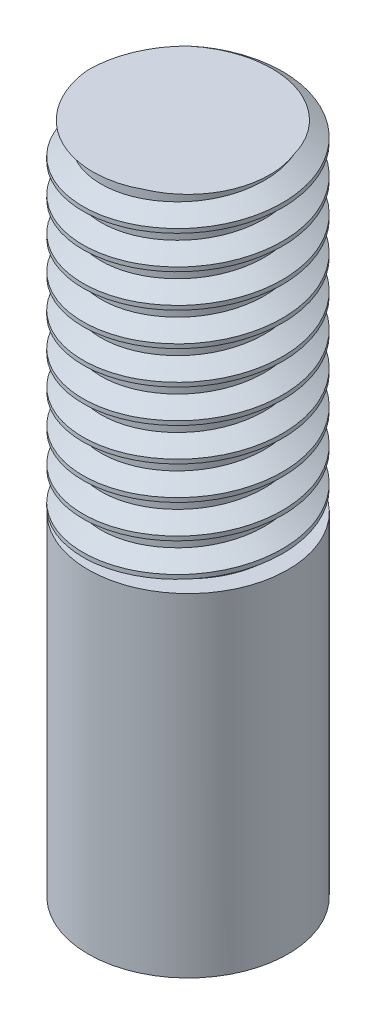
from build123d import *

# Parameters (mm, degrees)
SKETCH1_R           = 3
BOSS_EXTRUDE1_DEPTH = 10
THREAD1_PITCH       = 1
SKETCH13_R          = 3
BOSS_EXTRUDE2_DEPTH = 10


with BuildPart() as part:
    # Sketch1 → Boss-Extrude1 (new body)
    with BuildSketch(Plane(origin=(0, 0, 0), x_dir=(1, 0, 0), z_dir=(0, 1, 0))):
        with Locations(Location((-0.003925922, 0, 0), (0, 0, 270))):
            Circle(SKETCH1_R)
    extrude(amount=BOSS_EXTRUDE1_DEPTH)

    # Thread1: the profile of Thread Profile2 profile screwed along a right-hand helix of 12 turns, 8 arcs to a turn; built about Z, then put on its axis
    thread1_z = Axis((0, 0, 0), (0, 0, 1))
    thread1_corners = [(3.0003, 0, -0.000173205), (3.0003, 0, 0.875173202), (2.458734125, 0, 0.562499999), (2.458734125, 0, 0.312499999)]
    with BuildLine(mode=Mode.PRIVATE) as thread1_profile:
        Line(thread1_corners[0], thread1_corners[1])
        Line(thread1_corners[1], thread1_corners[2])
        Line(thread1_corners[2], thread1_corners[3])
        Line(thread1_corners[3], thread1_corners[0])
    thread1_cap = Face(thread1_profile.wire())
    thread1_turn_angles = [0, 22.5, 45, 67.5, 90, 112.5, 135, 157.5, 180, 202.5, 225, 247.5, 270, 292.5, 315, 337.5, 360]
    thread1_turn_weights = [1, 0.9238795325112867, 1, 0.9238795325112867, 1, 0.9238795325112867, 1, 0.9238795325112867, 1, 0.9238795325112867, 1, 0.9238795325112867, 1, 0.9238795325112867, 1, 0.9238795325112867, 1]
    thread1_turn_rails = [Edge.make_bspline([Vector(p[0], p[1], 0).rotate(thread1_z, thread1_turn_angles[k]) / thread1_turn_weights[k] + Vector(0, 0, p[2] + THREAD1_PITCH * thread1_turn_angles[k] / 360) for k in range(17)], [0, 0, 0, 1, 1, 2, 2, 3, 3, 4, 4, 5, 5, 6, 6, 7, 7, 8, 8, 8], 2, thread1_turn_weights) for p in thread1_corners]
    thread1_turn_sides = [Face.make_surface_from_curves(thread1_turn_rails[p[0]], thread1_turn_rails[p[1]]) for p in [(0, 1), (1, 2), (2, 3), (3, 0)]]
    thread1 = Plane(origin=(-0.003925922, 11, 0), x_dir=(-1, 0, 0), z_dir=(0, -1, 0)) * Solid(Shell([*[p.moved(Location((0, 0, THREAD1_PITCH * i))) for i in range(12) for p in thread1_turn_sides], thread1_cap, thread1_cap.rotate(thread1_z, 4320).moved(Location((0, 0, THREAD1_PITCH * 4320 / 360)))]))
    add(thread1, mode=Mode.SUBTRACT)

    # Sketch13 → Boss-Extrude2 (add)
    with BuildSketch(Plane(origin=(0, 0, 0), x_dir=(1, 0, 0), z_dir=(0, 1, 0))):
        with Locations(Location((0, 0, 0), (0, 0, 270))):
            Circle(SKETCH13_R)
    extrude(amount=-BOSS_EXTRUDE2_DEPTH)


solid = part.part
